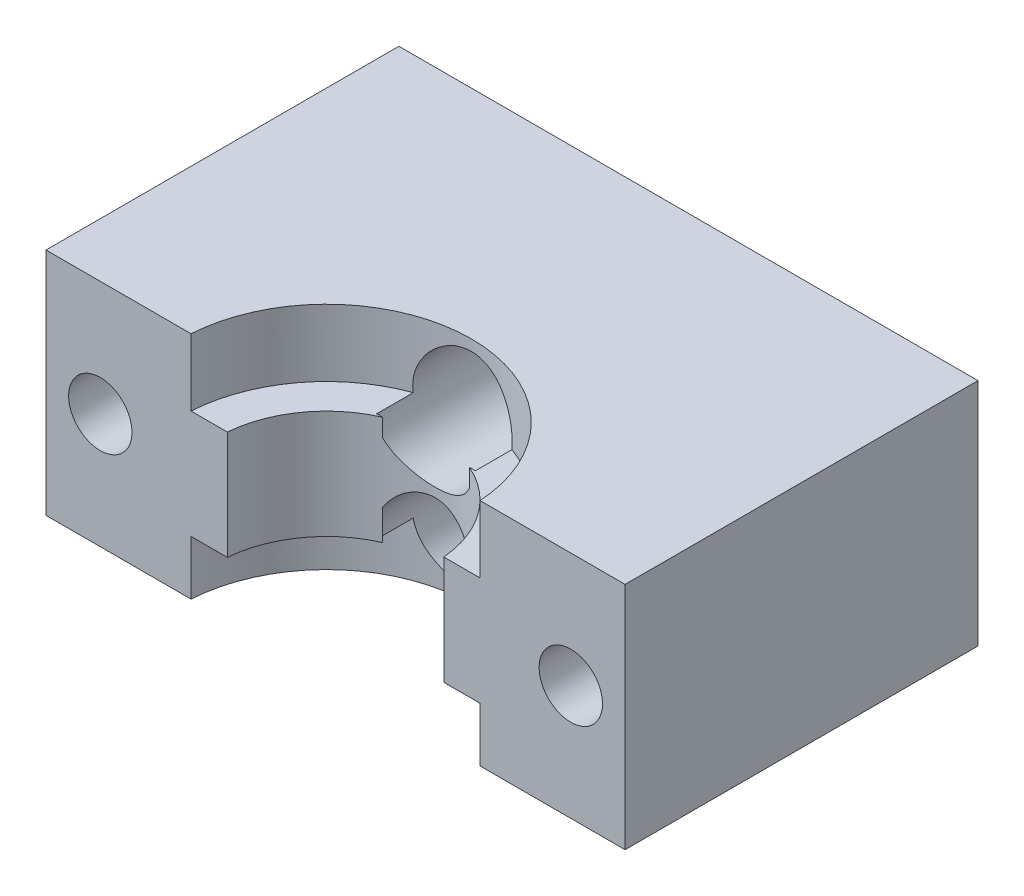
from build123d import *

# Parameters (mm, degrees)
SKETCH2_W           = 32
SKETCH2_H           = 12.7
SKETCH2_R           = 1.75
BOSS_EXTRUDE1_DEPTH = 19.5
SKETCH3_R           = 1.75
CUT_EXTRUDE1_DEPTH  = 27.011007285
CUT_EXTRUDE2_DEPTH  = 4
SKETCH5_R           = 8
CUT_EXTRUDE3_DEPTH  = 3.7
SKETCH9_R           = 6
CUT_EXTRUDE5_DEPTH  = 6
SKETCH10_R          = 8
CUT_EXTRUDE6_DEPTH  = 28.02480353
SKETCH6_R           = 2.75
CUT_EXTRUDE4_DEPTH  = 7.5


with BuildPart() as part:
    # Sketch2 → Boss-Extrude1 (new body)
    with BuildSketch(Plane.XY):
        Rectangle(SKETCH2_W, SKETCH2_H)
        with Locations((0, 3)):
            Circle(SKETCH2_R, mode=Mode.SUBTRACT)
        with Locations((0, -3)):
            Circle(SKETCH2_R, mode=Mode.SUBTRACT)
    extrude(amount=BOSS_EXTRUDE1_DEPTH)

    # Sketch3 → Cut-Extrude1 (cut, through all)
    with BuildSketch(Plane.XY.offset(19.5)):
        with Locations((-13, 0)):
            Circle(SKETCH3_R)
        with Locations((13, 0)):
            Circle(SKETCH3_R)
    extrude(amount=-CUT_EXTRUDE1_DEPTH, mode=Mode.SUBTRACT)

    # Sketch4 → Cut-Extrude2 (cut)
    with BuildSketch(Plane(origin=(0, 0, 0), x_dir=(-1, 0, 0), z_dir=(0, 0, -1))):
        Polygon((-10.5, -1.443375673), (-10.5, 1.443375673), (-13, 2.886751346), (-15.5, 1.443375673), (-15.5, -1.443375673), (-13, -2.886751346), align=None)
        Polygon((13, -2.886751346), (15.5, -1.443375673), (15.5, 1.443375673), (13, 2.886751346), (10.5, 1.443375673), (10.5, -1.443375673), align=None)
    extrude(amount=-CUT_EXTRUDE2_DEPTH, mode=Mode.SUBTRACT)

    # Sketch5 → Cut-Extrude3 (cut)
    with BuildSketch(Plane(origin=(0, 6.35, 0), x_dir=(1, 0, 0), z_dir=(0, 1, 0))):
        with Locations((0, -20)):
            Circle(SKETCH5_R)
    extrude(amount=-CUT_EXTRUDE3_DEPTH, mode=Mode.SUBTRACT)

    # Sketch9 → Cut-Extrude5 (cut)
    with BuildSketch(Plane(origin=(0, 2.65, 0), x_dir=(1, 0, 0), z_dir=(0, 1, 0))):
        with Locations((0, -20)):
            Circle(SKETCH9_R)
    extrude(amount=-CUT_EXTRUDE5_DEPTH, mode=Mode.SUBTRACT)

    # Sketch10 → Cut-Extrude6 (cut, through all)
    with BuildSketch(Plane(origin=(0, -3.35, 0), x_dir=(1, 0, 0), z_dir=(0, 1, 0))):
        with Locations((0, -20)):
            Circle(SKETCH10_R)
    extrude(amount=-CUT_EXTRUDE6_DEPTH, mode=Mode.SUBTRACT)

    # Sketch6 → Cut-Extrude4 (cut)
    with BuildSketch(Plane.XY.offset(14.5)):
        with Locations((0, 3)):
            Circle(SKETCH6_R)
        with Locations((0, -3)):
            Circle(SKETCH6_R)
    extrude(amount=-CUT_EXTRUDE4_DEPTH, mode=Mode.SUBTRACT)


solid = part.part
